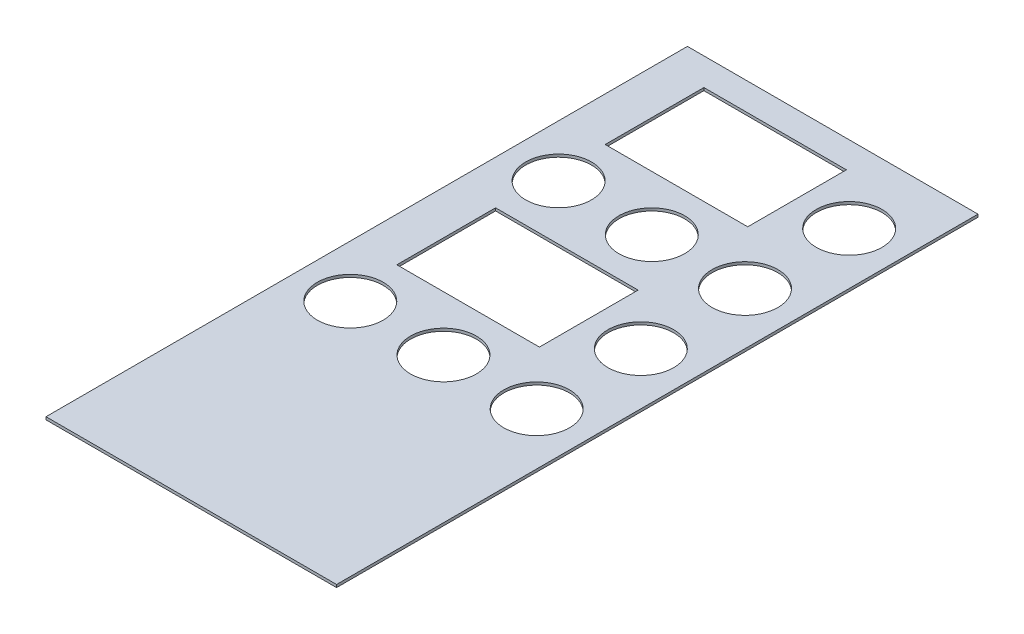
from build123d import *

# Parameters (mm, degrees)
SKETCH_1_W          = 53
SKETCH_1_H          = 117
EXTRUDE_1_DEPTH     = 0.5
SKETCH_2_W          = 26
SKETCH_2_H          = 18
CUT_EXTRUDE_1_DEPTH = 65.224216616
SKETCH_4_R          = 6
CUT_EXTRUDE_2_DEPTH = 65.224216616


with BuildPart() as part:
    # Эскиз1 → Бобышка-Вытянуть1 (new body)
    with BuildSketch(Plane(origin=(0, 0, 0), x_dir=(1, 0, 0), z_dir=(0, 1, 0))):
        Rectangle(SKETCH_1_W, SKETCH_1_H)
    extrude(amount=EXTRUDE_1_DEPTH)

    # Эскиз2 → Вырез-Вытянуть1 (cut, through all)
    with BuildSketch(Plane(origin=(0, 0.5, 0), x_dir=(1, 0, 0), z_dir=(0, 1, 0))):
        with Locations((-5.5, 44.5)):
            Rectangle(SKETCH_2_W, SKETCH_2_H)
        with Locations((-5.5, 6.5)):
            Rectangle(SKETCH_2_W, SKETCH_2_H)
    extrude(amount=-CUT_EXTRUDE_1_DEPTH, mode=Mode.SUBTRACT)

    # Эскиз4 → Вырез-Вытянуть2 (cut, through all)
    with BuildSketch(Plane(origin=(0, 0.5, 0), x_dir=(1, 0, 0), z_dir=(0, 1, 0))):
        with Locations((17, 44.5)):
            Circle(SKETCH_4_R)
        with Locations((17, 25.5)):
            Circle(SKETCH_4_R)
        with Locations((17, 6.5)):
            Circle(SKETCH_4_R)
        with Locations((17, -12.5)):
            Circle(SKETCH_4_R)
        with Locations((0, 25.5)):
            Circle(SKETCH_4_R)
        with Locations((-17, 25.5)):
            Circle(SKETCH_4_R)
        with Locations((0, -12.5)):
            Circle(SKETCH_4_R)
        with Locations((-17, -12.5)):
            Circle(SKETCH_4_R)
    extrude(amount=-CUT_EXTRUDE_2_DEPTH, mode=Mode.SUBTRACT)


solid = part.part
